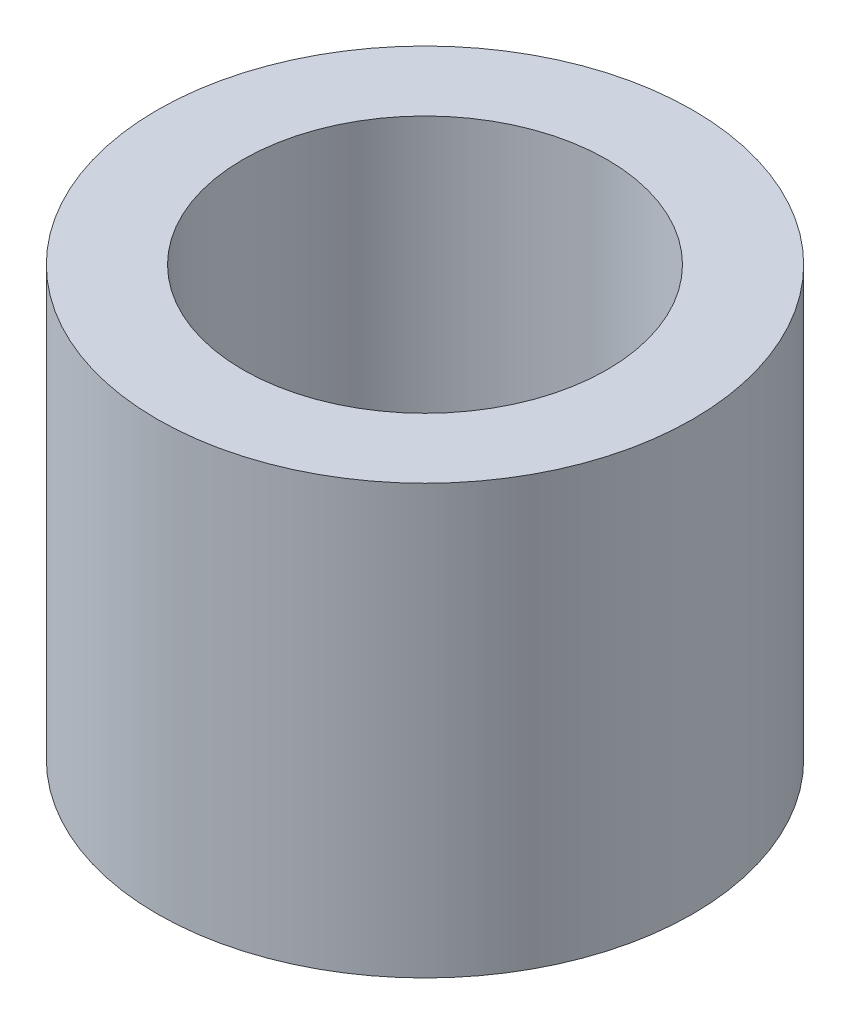
from build123d import *

# Parameters (mm, degrees)
SKETCH_1_R      = 2.5
SKETCH_1_R_2    = 1.7
EXTRUDE_1_DEPTH = 4


with BuildPart() as part:
    # Эскиз1 → Бобышка-Вытянуть1 (new body)
    with BuildSketch(Plane(origin=(0, 0, 0), x_dir=(1, 0, 0), z_dir=(0, 1, 0))):
        Circle(SKETCH_1_R)
        Circle(SKETCH_1_R_2, mode=Mode.SUBTRACT)
    extrude(amount=EXTRUDE_1_DEPTH)


solid = part.part
